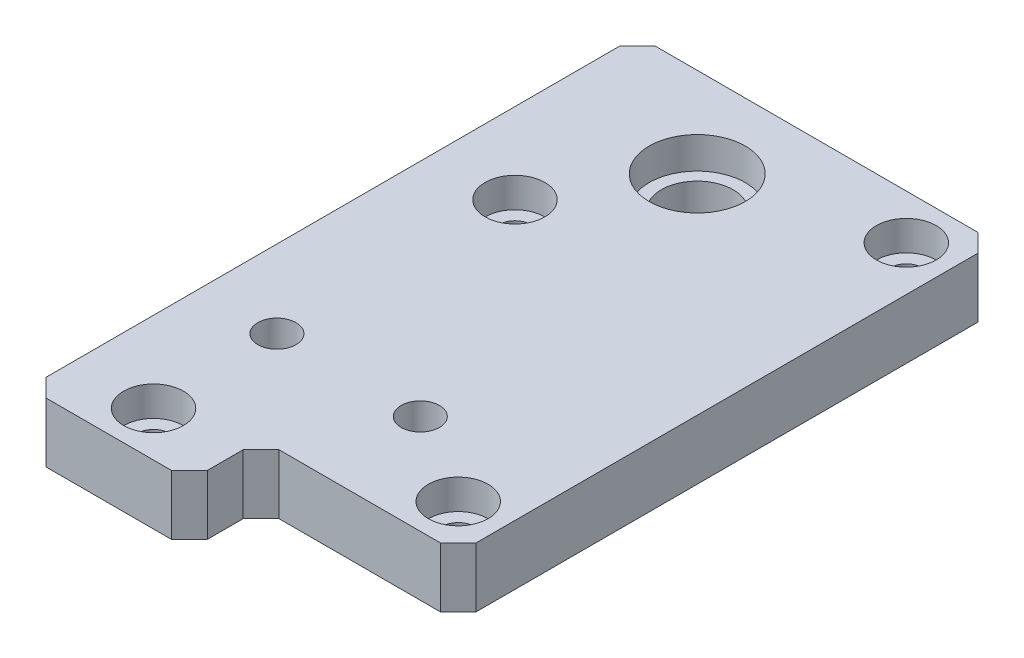
from build123d import *

# Parameters (mm, degrees)
BOSS_EXTRUDE1_DEPTH            = 10
CBORE_FOR_M5_SHCS1_D           = 5.5
CBORE_FOR_M5_SHCS1_CBORE_D     = 10
CBORE_FOR_M5_SHCS1_CBORE_DEPTH = 5
F_1_0MM_DOWEL_HOLE1_D          = 16.1
F_1_0MM_DOWEL_HOLE1_DEPTH      = 5.3
F_1_0MM_DOWEL_HOLE3_D          = 12
SKETCH14_R                     = 3.2
CUT_EXTRUDE1_DEPTH             = 68.631353676
CHAMFER1_SIZE                  = 3


with BuildPart() as part:
    # Sketch1 → Boss-Extrude1 (new body)
    with BuildSketch(Plane(origin=(0, 0, 0), x_dir=(1, 0, 0), z_dir=(0, 1, 0))):
        Polygon((2, -45), (35, -45), (35, 45), (-25, 45), (-25, -57), (2, -57), align=None)
    extrude(amount=BOSS_EXTRUDE1_DEPTH)

    # CBORE for M5 SHCS1 (through all)
    with Locations(Plane(origin=(0, 10, 0), x_dir=(1, 0, 0), z_dir=(0, 1, 0))):
        with Locations((27.5, 37.5), (27.5, -37.5), (-11.5, 11), (-11.5, -49.5)):
            CounterBoreHole(CBORE_FOR_M5_SHCS1_D / 2, CBORE_FOR_M5_SHCS1_CBORE_D / 2, CBORE_FOR_M5_SHCS1_CBORE_DEPTH)

    # Ø1.0mm Dowel Hole1
    with Locations(Plane(origin=(0, 10, 0), x_dir=(1, 0, 0), z_dir=(0, 1, 0))):
        with Locations((0, 30)):
            Hole(F_1_0MM_DOWEL_HOLE1_D / 2, depth=F_1_0MM_DOWEL_HOLE1_DEPTH)

    # Ø1.0mm Dowel Hole3 (through all)
    with Locations(Plane(origin=(0, 4.7, 0), x_dir=(1, 0, 0), z_dir=(0, 1, 0))):
        with Locations((0, 30)):
            Hole(F_1_0MM_DOWEL_HOLE3_D / 2)

    # Sketch14 → Cut-Extrude1 (cut, through all)
    with BuildSketch(Plane(origin=(0, 10, 0), x_dir=(1, 0, 0), z_dir=(0, 1, 0))):
        with Locations((12, -28.35)):
            Circle(SKETCH14_R)
        with Locations((-12, -28.35)):
            Circle(SKETCH14_R)
    extrude(amount=-CUT_EXTRUDE1_DEPTH, mode=Mode.SUBTRACT)

    # Chamfer1
    chamfer1_edges = [part.edges().sort_by_distance(p)[0] for p in [
        (35, 5, -45),
        (35, 5, 45),
        (2, 5, 45),
        (2, 5, 57),
        (-25, 5, 57),
        (-25, 5, -45),
    ]]
    chamfer(chamfer1_edges, length=CHAMFER1_SIZE)


solid = part.part
